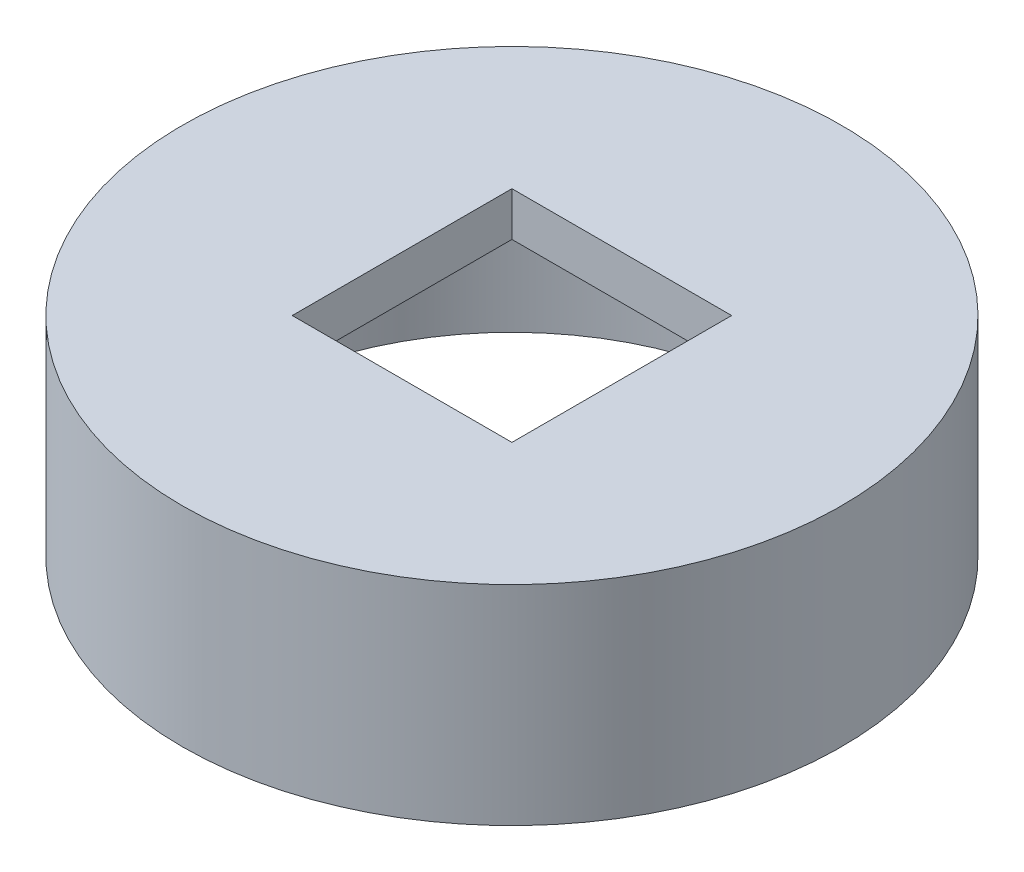
from build123d import *

# Parameters (mm, degrees)
SKETCH2_R           = 60
SKETCH2_R_2         = 50
BOSS_EXTRUDE1_DEPTH = 30
SKETCH3_R           = 60
BOSS_EXTRUDE2_DEPTH = 8
SKETCH5_W           = 40
SKETCH5_H           = 40
CUT_EXTRUDE1_DEPTH  = 93.973114393


with BuildPart() as part:
    # Sketch2 → Boss-Extrude1 (new body)
    with BuildSketch(Plane(origin=(0, 0, 0), x_dir=(1, 0, 0), z_dir=(0, 1, 0))):
        Circle(SKETCH2_R)
        Circle(SKETCH2_R_2, mode=Mode.SUBTRACT)
    extrude(amount=BOSS_EXTRUDE1_DEPTH)

    # Sketch3 → Boss-Extrude2 (add)
    with BuildSketch(Plane(origin=(0, 30, 0), x_dir=(1, 0, 0), z_dir=(0, 1, 0))):
        Circle(SKETCH3_R)
    extrude(amount=BOSS_EXTRUDE2_DEPTH)

    # Sketch5 → Cut-Extrude1 (cut, through all)
    with BuildSketch(Plane(origin=(0, 38, 0), x_dir=(1, 0, 0), z_dir=(0, 1, 0))):
        Rectangle(SKETCH5_W, SKETCH5_H)
    extrude(amount=-CUT_EXTRUDE1_DEPTH, mode=Mode.SUBTRACT)


solid = part.part
